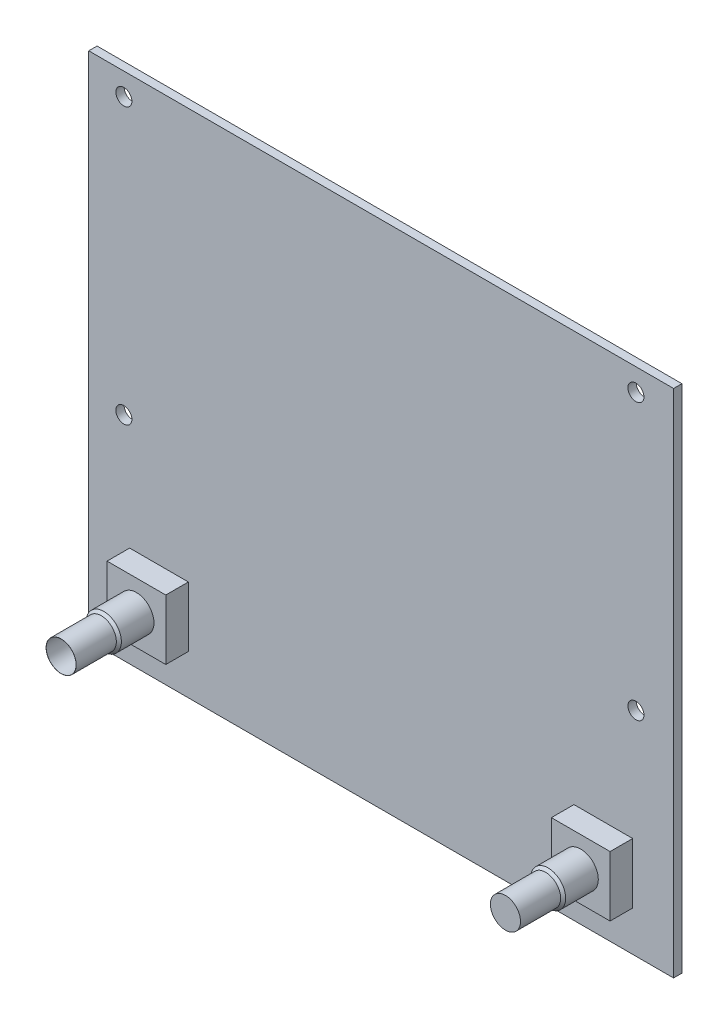
from build123d import *

# Parameters (mm, degrees)
SKETCH1_W           = 116.54028
SKETCH1_H           = 101.7397
SKETCH1_R           = 1.6002
BOSS_EXTRUDE1_DEPTH = 1.65608
SKETCH2_W           = 11.69924
SKETCH2_H           = 11.99896
BOSS_EXTRUDE2_DEPTH = 4.5
SKETCH3_R           = 3.5
BOSS_EXTRUDE3_DEPTH = 7
CHAMFER1_SIZE       = 0.5
SKETCH5_R           = 3
SKETCH5_R_2         = 2.97815
BOSS_EXTRUDE4_DEPTH = 8
SKETCH6_W           = 77.0509
SKETCH6_H           = 20.6502
CUT_EXTRUDE1_DEPTH  = 1


with BuildPart() as part:
    # Sketch1 → Boss-Extrude1 (new body)
    with BuildSketch(Plane.XY):
        Rectangle(SKETCH1_W, SKETCH1_H)
        with Locations((-51.2699, 46.45025)):
            Circle(SKETCH1_R, mode=Mode.SUBTRACT)
        with Locations((50.76952, 46.45025)):
            Circle(SKETCH1_R, mode=Mode.SUBTRACT)
        with Locations((50.76952, -8.44931)):
            Circle(SKETCH1_R, mode=Mode.SUBTRACT)
        with Locations((-51.2699, -8.44931)):
            Circle(SKETCH1_R, mode=Mode.SUBTRACT)
    extrude(amount=BOSS_EXTRUDE1_DEPTH)

    # Sketch2 → Boss-Extrude2 (add)
    with BuildSketch(Plane.XY.offset(1.65608)):
        with Locations((-44.26966, -36.86937)):
            Rectangle(SKETCH2_W, SKETCH2_H)
        with Locations((44.26966, -36.86937)):
            Rectangle(SKETCH2_W, SKETCH2_H)
    extrude(amount=BOSS_EXTRUDE2_DEPTH)

    # Sketch3 → Boss-Extrude3 (add)
    with BuildSketch(Plane.XY.offset(6.15608)):
        with Locations((-44.26966, -36.86937)):
            Circle(SKETCH3_R)
        with Locations((44.26966, -36.86937)):
            Circle(SKETCH3_R)
    extrude(amount=BOSS_EXTRUDE3_DEPTH)

    # Chamfer1
    chamfer1_edges = [part.edges().sort_by_distance(p)[0] for p in [
        (-47.76966, -36.86937, 13.15608),
        (40.76966, -36.86937, 13.15608),
    ]]
    chamfer(chamfer1_edges, length=CHAMFER1_SIZE)

    # Sketch5 → Boss-Extrude4 (add)
    # profile 1 of 2: a face of its own
    with BuildSketch(Plane.XY.offset(13.15608)):
        with Locations((44.26966, -36.86937)):
            Circle(SKETCH5_R)
    # profile 2 of 2: a face of its own
    with BuildSketch(Plane.XY.offset(13.15608)):
        with Locations((-44.26966, -36.86937)):
            Circle(SKETCH5_R)
        with Locations((-44.26966, -36.86937)):
            Circle(SKETCH5_R_2, mode=Mode.SUBTRACT)
    extrude(amount=BOSS_EXTRUDE4_DEPTH)

    # Sketch6 → Cut-Extrude1 (cut)
    with BuildSketch(Plane(origin=(0, 0, 0), x_dir=(-1, 0, 0), z_dir=(0, 0, -1))):
        with Locations((0.73025, 26.13025)):
            Rectangle(SKETCH6_W, SKETCH6_H)
    extrude(amount=-CUT_EXTRUDE1_DEPTH, mode=Mode.SUBTRACT)


solid = part.part
